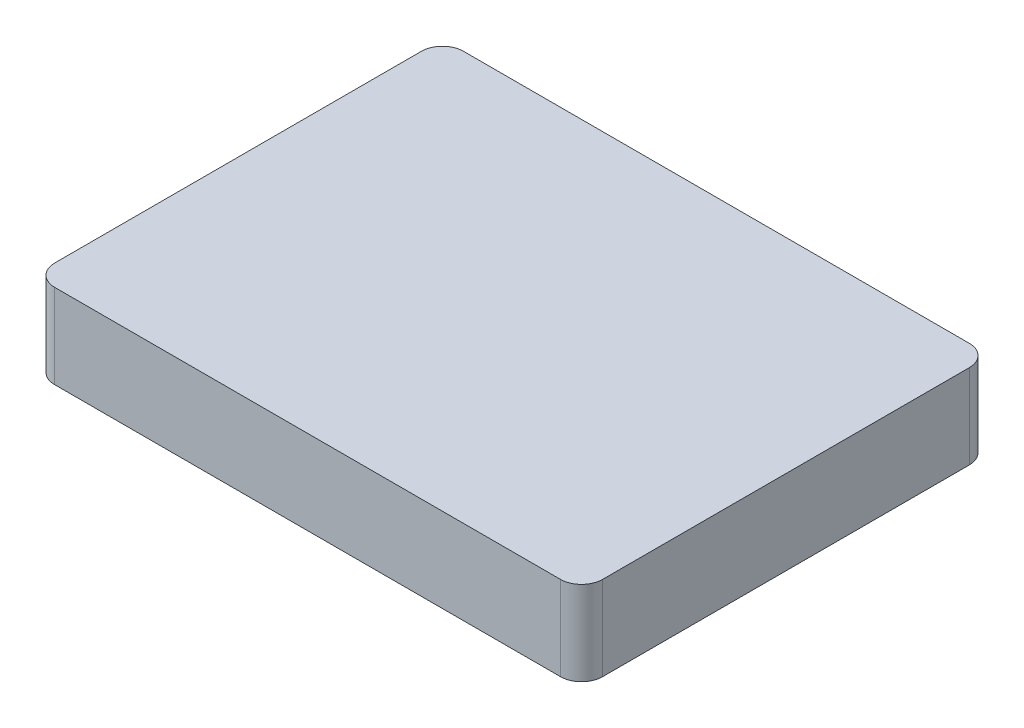
from build123d import *

# Parameters (mm, degrees)
SKETCH1_W           = 130
SKETCH1_H           = 97
BOSS_EXTRUDE1_DEPTH = 20
FILLET1_R           = 5


with BuildPart() as part:
    # Sketch1 → Boss-Extrude1 (new body)
    with BuildSketch(Plane(origin=(0, 0, 0), x_dir=(1, 0, 0), z_dir=(0, 1, 0))):
        Rectangle(SKETCH1_W, SKETCH1_H)
    extrude(amount=-BOSS_EXTRUDE1_DEPTH)

    # Fillet1
    fillet1_edges = [part.edges().sort_by_distance(p)[0] for p in [
        (-65, -10, -48.5),
        (-65, -10, 48.5),
        (65, -10, -48.5),
        (65, -10, 48.5),
    ]]
    fillet(fillet1_edges, radius=FILLET1_R)


solid = part.part
